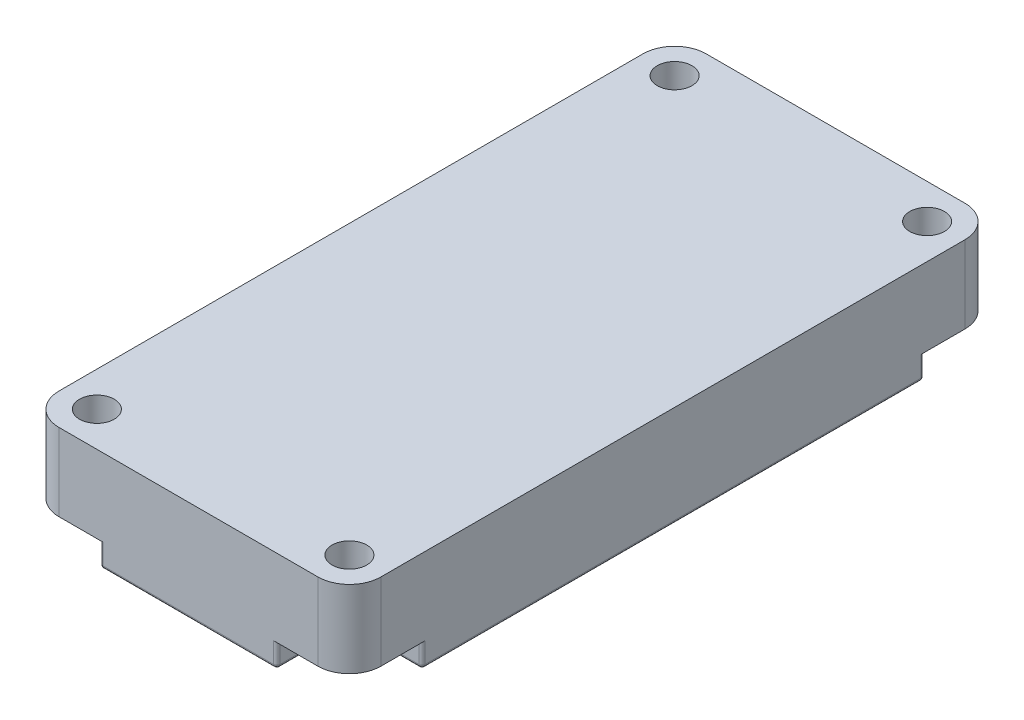
from build123d import *

# Parameters (mm, degrees)
SKETCH1_W            = 20.4
SKETCH1_H            = 41
BOSS_EXTRUDE1_DEPTH  = 6.4
CUT_EXTRUDE1_DEPTH   = 1.5
M2_CLEARANCE_HOLE1_D = 2.2
MIRROR2_COPY_1_DEPTH = 1.5
MIRROR2_COPY_2_D     = 2.2
FILLET1_R            = 0.2
FILLET2_R            = 0.2
FILLET3_R            = 2


with BuildPart() as part:
    # Sketch1 → Boss-Extrude1 (new body)
    with BuildSketch(Plane(origin=(0, 0, 0), x_dir=(1, 0, 0), z_dir=(0, 1, 0))):
        Rectangle(SKETCH1_W, SKETCH1_H)
    extrude(amount=-BOSS_EXTRUDE1_DEPTH)

    # Sketch2 → Cut-Extrude1 (cut)
    with BuildSketch(Plane(origin=(0, -6.4, 0), x_dir=(-1, 0, 0), z_dir=(0, -1, 0))):
        with BuildLine():
            Line((5.6, -17.7), (5.6, -20.5))
            Line((5.6, -20.5), (10.2, -20.5))
            Line((10.2, -20.5), (10.2, -15.9))
            Line((10.2, -15.9), (7.4, -15.9))
            ThreePointArc((7.4, -15.9), (6.127207794, -16.427207794), (5.6, -17.7))
        make_face()
    cut_extrude1 = extrude(amount=-CUT_EXTRUDE1_DEPTH, mode=Mode.SUBTRACT)

    # M2 Clearance Hole1 (through all)
    with Locations(Plane(origin=(0, -4.9, 0), x_dir=(-1, 0, 0), z_dir=(0, -1, 0))):
        with Locations((8, -18.3)):
            m2_clearance_hole1 = Hole(M2_CLEARANCE_HOLE1_D / 2)

    # Mirror1: Cut-Extrude1, M2 Clearance Hole1 across plane
    add(cut_extrude1.mirror(Plane(origin=(0, 0, 0), x_dir=(0, 0, 1), z_dir=(1, 0, 0))), mode=Mode.SUBTRACT)
    add(m2_clearance_hole1.mirror(Plane(origin=(0, 0, 0), x_dir=(0, 0, 1), z_dir=(1, 0, 0))), mode=Mode.SUBTRACT)

    # Mirror2: Cut-Extrude1, M2 Clearance Hole1 across plane
    add(cut_extrude1.mirror(Plane.XY), mode=Mode.SUBTRACT)
    add(m2_clearance_hole1.mirror(Plane.XY), mode=Mode.SUBTRACT)

    # Mirror2 copy 1 sketch → Mirror2 copy 1 (cut)
    with BuildSketch(Plane.XZ.offset(6.4)):
        with BuildLine():
            Line((5.6, -17.7), (5.6, -20.5))
            Line((5.6, -20.5), (10.2, -20.5))
            Line((10.2, -20.5), (10.2, -15.9))
            Line((10.2, -15.9), (7.4, -15.9))
            ThreePointArc((7.4, -15.9), (6.127207794, -16.427207794), (5.6, -17.7))
        make_face()
    extrude(amount=-MIRROR2_COPY_1_DEPTH, mode=Mode.SUBTRACT)

    # Mirror2 copy 2 (through all)
    with Locations(Plane.XZ.offset(4.9)):
        with Locations((8, -18.3)):
            Hole(MIRROR2_COPY_2_D / 2)

    # Fillet1
    fillet1_edges = [part.edges().sort_by_distance(p)[0] for p in [
        (0, -6.4, 20.5),
        (-6.127207794, -6.4, 16.427207794),
        (-5.6, -6.4, 19.1),
        (-8.8, -6.4, 15.9),
        (10.2, -6.4, 0),
        (6.127207794, -6.4, 16.427207794),
        (5.6, -6.4, 19.1),
        (8.8, -6.4, 15.9),
        (-10.2, -6.4, 0),
        (-6.127207794, -6.4, -16.427207794),
        (-5.6, -6.4, -19.1),
        (-8.8, -6.4, -15.9),
        (0, -6.4, -20.5),
        (6.127207794, -6.4, -16.427207794),
        (5.6, -6.4, -19.1),
        (8.8, -6.4, -15.9),
    ]]
    fillet(fillet1_edges, radius=FILLET1_R)

    # Fillet2
    # the kernel refuses this fillet: 0.2 mm, written as the material it takes off along each edge
    with BuildSketch(Plane(origin=(-5.4, -6.2, 20.3), x_dir=(-1, 0, 0), z_dir=(0, 0, 1))) as fillet2_piece_1_section:
        Polygon((0, 0), (FILLET2_R, 0), (FILLET2_R, FILLET2_R), (0, FILLET2_R), align=None)
    fillet2_piece_1 = extrude(amount=FILLET2_R, mode=Mode.PRIVATE)
    fillet2_piece_1 = fillet2_piece_1 - Plane(origin=(-5.4, -6.2, 20.3), x_dir=(0.7071067811865475, 0.7071067811865475, 0), z_dir=(0, 0, 1)) * Sphere(FILLET2_R, mode=Mode.PRIVATE)
    add(fillet2_piece_1, mode=Mode.SUBTRACT)
    with BuildSketch(Plane(origin=(5.4, -6.2, 20.3), x_dir=(1, 0, 0), z_dir=(0, 0, 1))) as fillet2_piece_2_section:
        Polygon((0, 0), (FILLET2_R, 0), (FILLET2_R, -FILLET2_R), (0, -FILLET2_R), align=None)
    fillet2_piece_2 = extrude(amount=FILLET2_R, mode=Mode.PRIVATE)
    fillet2_piece_2 = fillet2_piece_2 - Plane(origin=(5.4, -6.2, 20.3), x_dir=(-0.7071067811865475, 0.7071067811865475, 0), z_dir=(0, 0, 1)) * Sphere(FILLET2_R, mode=Mode.PRIVATE)
    add(fillet2_piece_2, mode=Mode.SUBTRACT)
    with BuildSketch(Plane(origin=(-10, -6.2, 15.7), x_dir=(0, 0, 1), z_dir=(-1, 0, 0))) as fillet2_piece_3_section:
        Polygon((0, 0), (FILLET2_R, 0), (FILLET2_R, -FILLET2_R), (0, -FILLET2_R), align=None)
    fillet2_piece_3 = extrude(amount=FILLET2_R, mode=Mode.PRIVATE)
    fillet2_piece_3 = fillet2_piece_3 - Plane(origin=(-10, -6.2, 15.7), x_dir=(0, 0.7071067811865475, -0.7071067811865475), z_dir=(-1, 0, 0)) * Sphere(FILLET2_R, mode=Mode.PRIVATE)
    add(fillet2_piece_3, mode=Mode.SUBTRACT)
    with BuildSketch(Plane(origin=(-10, -6.2, -15.7), x_dir=(0, 0, -1), z_dir=(-1, 0, 0))) as fillet2_piece_4_section:
        Polygon((0, 0), (FILLET2_R, 0), (FILLET2_R, FILLET2_R), (0, FILLET2_R), align=None)
    fillet2_piece_4 = extrude(amount=FILLET2_R, mode=Mode.PRIVATE)
    fillet2_piece_4 = fillet2_piece_4 - Plane(origin=(-10, -6.2, -15.7), x_dir=(0, 0.7071067811865475, 0.7071067811865475), z_dir=(-1, 0, 0)) * Sphere(FILLET2_R, mode=Mode.PRIVATE)
    add(fillet2_piece_4, mode=Mode.SUBTRACT)
    with BuildSketch(Plane(origin=(10, -6.2, 15.7), x_dir=(0, 0, 1), z_dir=(1, 0, 0))) as fillet2_piece_5_section:
        Polygon((0, 0), (FILLET2_R, 0), (FILLET2_R, FILLET2_R), (0, FILLET2_R), align=None)
    fillet2_piece_5 = extrude(amount=FILLET2_R, mode=Mode.PRIVATE)
    fillet2_piece_5 = fillet2_piece_5 - Plane(origin=(10, -6.2, 15.7), x_dir=(0, 0.7071067811865475, -0.7071067811865475), z_dir=(1, 0, 0)) * Sphere(FILLET2_R, mode=Mode.PRIVATE)
    add(fillet2_piece_5, mode=Mode.SUBTRACT)
    with BuildSketch(Plane(origin=(10, -6.2, -15.7), x_dir=(0, 0, -1), z_dir=(1, 0, 0))) as fillet2_piece_6_section:
        Polygon((0, 0), (FILLET2_R, 0), (FILLET2_R, -FILLET2_R), (0, -FILLET2_R), align=None)
    fillet2_piece_6 = extrude(amount=FILLET2_R, mode=Mode.PRIVATE)
    fillet2_piece_6 = fillet2_piece_6 - Plane(origin=(10, -6.2, -15.7), x_dir=(0, 0.7071067811865475, 0.7071067811865475), z_dir=(1, 0, 0)) * Sphere(FILLET2_R, mode=Mode.PRIVATE)
    add(fillet2_piece_6, mode=Mode.SUBTRACT)
    with BuildSketch(Plane(origin=(-5.4, -6.2, -20.3), x_dir=(-1, 0, 0), z_dir=(0, 0, -1))) as fillet2_piece_7_section:
        Polygon((0, 0), (FILLET2_R, 0), (FILLET2_R, -FILLET2_R), (0, -FILLET2_R), align=None)
    fillet2_piece_7 = extrude(amount=FILLET2_R, mode=Mode.PRIVATE)
    fillet2_piece_7 = fillet2_piece_7 - Plane(origin=(-5.4, -6.2, -20.3), x_dir=(0.7071067811865475, 0.7071067811865475, 0), z_dir=(0, 0, -1)) * Sphere(FILLET2_R, mode=Mode.PRIVATE)
    add(fillet2_piece_7, mode=Mode.SUBTRACT)
    with BuildSketch(Plane(origin=(5.4, -6.2, -20.3), x_dir=(1, 0, 0), z_dir=(0, 0, -1))) as fillet2_piece_8_section:
        Polygon((0, 0), (FILLET2_R, 0), (FILLET2_R, FILLET2_R), (0, FILLET2_R), align=None)
    fillet2_piece_8 = extrude(amount=FILLET2_R, mode=Mode.PRIVATE)
    fillet2_piece_8 = fillet2_piece_8 - Plane(origin=(5.4, -6.2, -20.3), x_dir=(-0.7071067811865475, 0.7071067811865475, 0), z_dir=(0, 0, -1)) * Sphere(FILLET2_R, mode=Mode.PRIVATE)
    add(fillet2_piece_8, mode=Mode.SUBTRACT)
    with BuildSketch(Plane(origin=(-10.2, -6.2, 15.9), x_dir=(0, 0, -1), z_dir=(0, 1, 0)), Plane(origin=(5.6, -6.2, 20.5), x_dir=(-1, 0, 0), z_dir=(0, 1, 0)), Plane(origin=(-5.6, -6.2, -20.5), x_dir=(1, 0, 0), z_dir=(0, 1, 0)), Plane(origin=(10.2, -6.2, -15.9), x_dir=(0, 0, 1), z_dir=(0, 1, 0))) as fillet2_piece_9:
        with BuildLine():
            CenterArc((FILLET2_R, -FILLET2_R), FILLET2_R, 90, 90)
            Line((0, -FILLET2_R), (0, 0))
            Line((0, 0), (FILLET2_R, 0))
        make_face()
    extrude(amount=1.3, mode=Mode.SUBTRACT)
    with BuildSketch(Plane(origin=(-5.6, -6.2, 20.5), x_dir=(1, 0, 0), z_dir=(0, 1, 0)), Plane(origin=(10.2, -6.2, 15.9), x_dir=(0, 0, -1), z_dir=(0, 1, 0)), Plane(origin=(-10.2, -6.2, -15.9), x_dir=(0, 0, 1), z_dir=(0, 1, 0)), Plane(origin=(5.6, -6.2, -20.5), x_dir=(-1, 0, 0), z_dir=(0, 1, 0))) as fillet2_piece_10:
        with BuildLine():
            CenterArc((FILLET2_R, FILLET2_R), FILLET2_R, 180, 90)
            Line((0, FILLET2_R), (0, 0))
            Line((0, 0), (FILLET2_R, 0))
        make_face()
    extrude(amount=1.3, mode=Mode.SUBTRACT)

    # Fillet3
    fillet3_edges = [part.edges().sort_by_distance(p)[0] for p in [
        (-10.2, -2.45, 20.5),
        (10.2, -2.45, 20.5),
        (-10.2, -2.45, -20.5),
        (10.2, -2.45, -20.5),
    ]]
    fillet(fillet3_edges, radius=FILLET3_R)


solid = part.part
